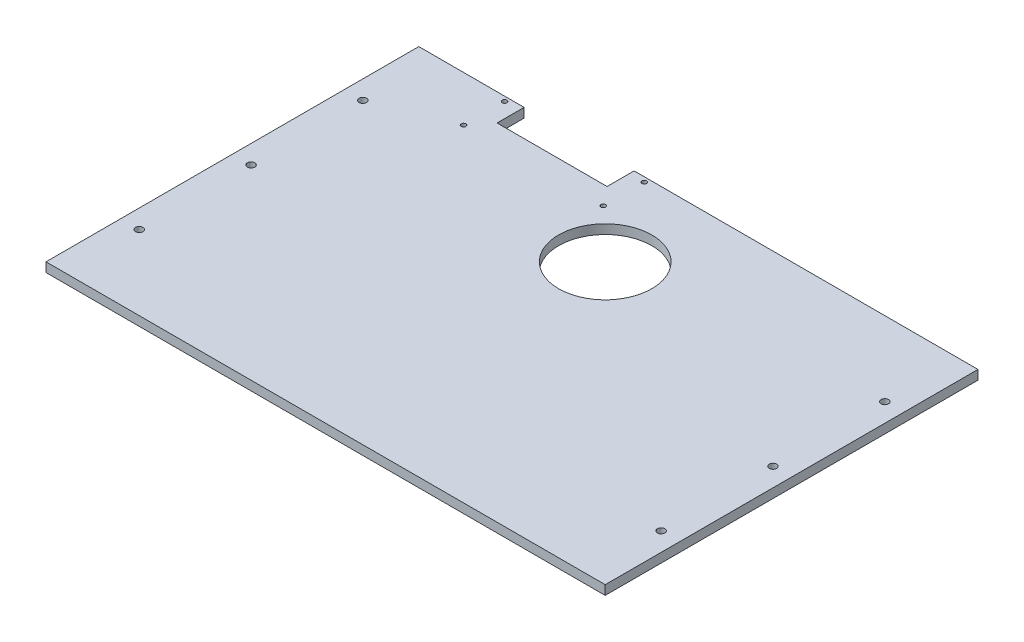
from build123d import *

# Parameters (mm, degrees)
SKETCH1_W           = 300
SKETCH1_H           = 200
BOSS_EXTRUDE1_DEPTH = 5
SKETCH2_R           = 2
SKETCH2_R_2         = 25
CUT_EXTRUDE2_DEPTH  = 181.346887969
SKETCH4_R           = 1.25
CUT_EXTRUDE3_DEPTH  = 181.346887969
SKETCH6_W           = 59
SKETCH6_H           = 14.5
CUT_EXTRUDE4_DEPTH  = 5


with BuildPart() as part:
    # Sketch1 → Boss-Extrude1 (new body)
    with BuildSketch(Plane(origin=(0, 0, 0), x_dir=(1, 0, 0), z_dir=(0, 1, 0))):
        Rectangle(SKETCH1_W, SKETCH1_H)
    extrude(amount=BOSS_EXTRUDE1_DEPTH)

    # Sketch2 → Cut-Extrude2 (cut, through all)
    with BuildSketch(Plane(origin=(0, 5, 0), x_dir=(1, 0, 0), z_dir=(0, 1, 0))):
        with Locations((-140, 0)):
            Circle(SKETCH2_R)
        with Locations((-140, 60)):
            Circle(SKETCH2_R)
        with Locations((-140, -60)):
            Circle(SKETCH2_R)
        with Locations((140, -60)):
            Circle(SKETCH2_R)
        with Locations((140, 60)):
            Circle(SKETCH2_R)
        with Locations((140, 0)):
            Circle(SKETCH2_R)
        with Locations((0, 50)):
            Circle(SKETCH2_R_2)
    extrude(amount=-CUT_EXTRUDE2_DEPTH, mode=Mode.SUBTRACT)

    # Sketch4 → Cut-Extrude3 (cut, through all)
    with BuildSketch(Plane(origin=(0, 5, 0), x_dir=(1, 0, 0), z_dir=(0, 1, 0))):
        with Locations((-101.5, 97.5)):
            Circle(SKETCH4_R)
        with Locations((-26.5, 97.5)):
            Circle(SKETCH4_R)
        with Locations((-26.5, 75.5)):
            Circle(SKETCH4_R)
        with Locations((-101.5, 75.5)):
            Circle(SKETCH4_R)
    extrude(amount=-CUT_EXTRUDE3_DEPTH, mode=Mode.SUBTRACT)

    # Sketch6 → Cut-Extrude4 (cut)
    with BuildSketch(Plane.XZ):
        with Locations((-64, -92.75)):
            Rectangle(SKETCH6_W, SKETCH6_H)
    extrude(amount=-CUT_EXTRUDE4_DEPTH, mode=Mode.SUBTRACT)


solid = part.part
